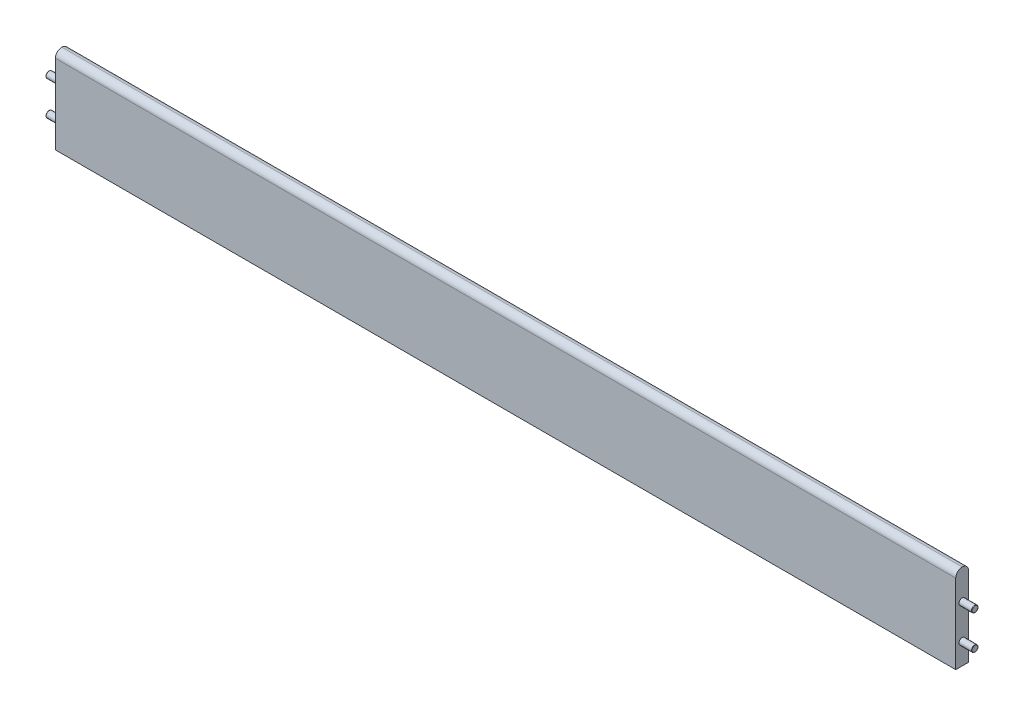
from build123d import *

# Parameters (mm, degrees)
SCHIZZO1_W                   = 2100
SCHIZZO1_H                   = 200
ESTRUSIONE_ESTRUSIONE1_DEPTH = 30
RACCORDO1_R                  = 15
SCHIZZO3_R                   = 7.5
ESTRUSIONE_ESTRUSIONE2_DEPTH = 30
RACCORDO2_R                  = 1
ESTRUSIONE_ESTRUSIONE3_START = 30
SCHIZZO4_R                   = 7.5
ESTRUSIONE_ESTRUSIONE3_DEPTH = 30
RACCORDO3_R                  = 1


with BuildPart() as part:
    # Schizzo1 → Estrusione-Estrusione1 (new body)
    with BuildSketch(Plane.XY):
        with Locations((1050, -100)):
            Rectangle(SCHIZZO1_W, SCHIZZO1_H)
    extrude(amount=ESTRUSIONE_ESTRUSIONE1_DEPTH)

    # Raccordo1
    raccordo1_edges = [part.edges().sort_by_distance(p)[0] for p in [
        (1050, 0, 0),
        (1050, 0, 30),
    ]]
    fillet(raccordo1_edges, radius=RACCORDO1_R - 0.0001)  # a hair under: the kernel refuses the full size

    # Schizzo3 → Estrusione-Estrusione2 (add)
    with BuildSketch(Plane(origin=(2100, 0, 0), x_dir=(0, 0, -1), z_dir=(1, 0, 0))):
        with Locations(Location((-15, -70, 0), (0, 0, 180))):
            Circle(SCHIZZO3_R)
        with Locations(Location((-15, -150, 0), (0, 0, 180))):
            Circle(SCHIZZO3_R)
    extrude(amount=ESTRUSIONE_ESTRUSIONE2_DEPTH)

    # Raccordo2
    raccordo2_edges = [part.edges().sort_by_distance(p)[0] for p in [
        (2130, -70, 7.5),
        (2130, -150, 7.5),
    ]]
    fillet(raccordo2_edges, radius=RACCORDO2_R)

    # Schizzo4 → Estrusione-Estrusione3 (add)
    with BuildSketch(Plane.ZY.offset(ESTRUSIONE_ESTRUSIONE3_START)):
        with Locations((15, -70)):
            Circle(SCHIZZO4_R)
        with Locations((15, -150)):
            Circle(SCHIZZO4_R)
    extrude(amount=-ESTRUSIONE_ESTRUSIONE3_DEPTH)

    # Raccordo3
    raccordo3_edges = [part.edges().sort_by_distance(p)[0] for p in [
        (-30, -70, 7.5),
        (-30, -150, 7.5),
    ]]
    fillet(raccordo3_edges, radius=RACCORDO3_R)


solid = part.part
